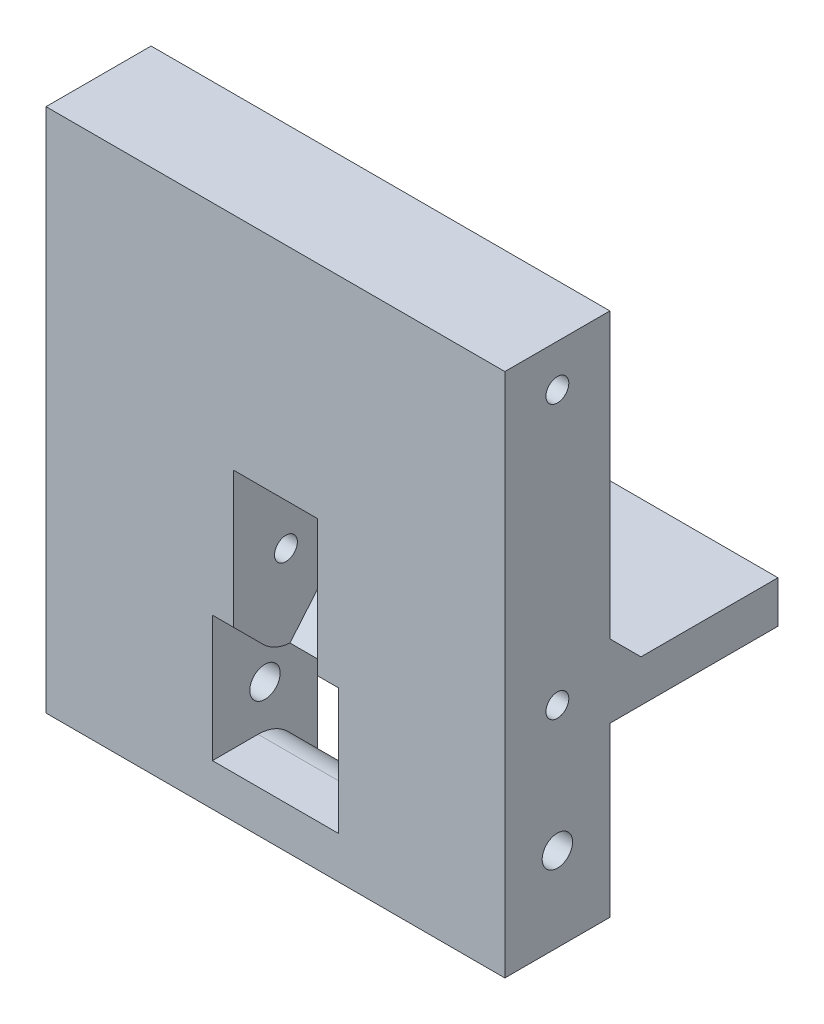
from build123d import *

# Parameters (mm, degrees)
SKETCH2_W               = 15.875
SKETCH2_H               = 79.375
SKETCH2_R               = 1.7272
SKETCH2_W_2             = 25.4
SKETCH2_H_2             = 6.35
BOSS_EXTRUDE1_DEPTH     = 69.85
SKETCH3_W               = 19.05
SKETCH3_H               = 12.7
CUT_EXTRUDE1_DEPTH      = 127
SKETCH4_R               = 2.2950679
CUT_EXTRUDE2_DEPTH      = 127
CHAMFER1_SIZE           = 6.35
FILLET2_R               = 6.35
CUT_EXTRUDE3_DEPTH      = 6.35
CUT_EXTRUDE3_DEPTH_BACK = 6.35
SKETCH8_R               = 2.4
SKETCH10_W              = 9.525
SKETCH10_H              = 4.699
BOSS_EXTRUDE2_DEPTH     = 12.7
SKETCH12_R              = 0.8763
CUT_EXTRUDE4_DEPTH      = 132.769283049
CHAMFER2_SIZE           = 4.7752
CHAMFER2_SIZE_2         = 12.7
CHAMFER3_SIZE           = 4.70154
CHAMFER4_SIZE           = 6.35
CHAMFER4_SIZE_2         = 12.7
CUT_EXTRUDE5_DEPTH      = 0.254
CUT_EXTRUDE6_DEPTH      = 0.254


# Some blends are built 0.0001 mm under size
with BuildPart() as part:
    # Sketch2 → Boss-Extrude1 (new body)
    # profile 1 of 2: a face of its own
    with BuildSketch(Plane.ZY.offset(62.053242547)):
        with Locations((17.149745439, 79.910239505)):
            Rectangle(SKETCH2_W, SKETCH2_H)
        with Locations((17.149745439, 113.247739505)):
            Circle(SKETCH2_R, mode=Mode.SUBTRACT)
        with Locations((17.149745439, 71.972739505)):
            Circle(SKETCH2_R, mode=Mode.SUBTRACT)
    # profile 2 of 2: a face of its own
    with BuildSketch(Plane.ZY.offset(62.053242547)):
        with Locations((-3.487754561, 68.797739505)):
            Rectangle(SKETCH2_W_2, SKETCH2_H_2)
    extrude(amount=-BOSS_EXTRUDE1_DEPTH)

    # Sketch3 → Cut-Extrude1 (cut)
    with BuildSketch(Plane(origin=(0, 0, 9.212245439), x_dir=(-1, 0, 0), z_dir=(0, 0, -1))):
        with Locations((27.128242547, 52.922739505)):
            Rectangle(SKETCH3_W, SKETCH3_H)
    extrude(amount=-CUT_EXTRUDE1_DEPTH, mode=Mode.SUBTRACT)

    # Sketch4 → Cut-Extrude2 (cut)
    with BuildSketch(Plane(origin=(7.796757453, 0, 0), x_dir=(0, 0, -1), z_dir=(1, 0, 0))):
        with Locations(Location((-17.149745439, 52.922739505, 0), (0, 0, 180))):
            Circle(SKETCH4_R)
    extrude(amount=-CUT_EXTRUDE2_DEPTH, mode=Mode.SUBTRACT)

    # Chamfer1
    chamfer1_edges = [part.edges().sort_by_distance(p)[0] for p in [
        (-27.128242547, 59.272739505, 25.087245439),
        (-27.128242547, 46.572739505, 9.212245439),
    ]]
    chamfer(chamfer1_edges, length=CHAMFER1_SIZE - 0.0001)  # a hair under: the kernel refuses the full size

    # Fillet2
    fillet2_edges = [part.edges().sort_by_distance(p)[0] for p in [
        (-27.128242547, 59.272739505, 18.737345439),
        (-27.128242547, 46.572739505, 15.562145439),
    ]]
    fillet(fillet2_edges, radius=FILLET2_R)

    # Sketch8 → Cut-Extrude3 (cut, two sides: drawn at the far end of the back side and taken through both)
    # profile 1 of 5: a face of its own
    with BuildSketch(Plane(origin=(-27.128242547, 59.272739505, 33.482952844), x_dir=(0, 0, 1), z_dir=(-1, 0, 0)).offset(-CUT_EXTRUDE3_DEPTH_BACK)):
        with BuildLine():
            Line((-7.077924175, -7.789561181), (-20.085542155, 7.712314277))
            ThreePointArc((-20.085542155, 7.712314277), (-21.190808514, 7.041102183), (-22.339064084, 6.446418612))
            Line((-22.339064084, 6.446418612), (-9.023677061, -9.422241709))
            Line((-9.023677061, -9.422241709), (-7.077924175, -7.789561181))
        make_face()
    # profile 2 of 5: a face of its own
    with BuildSketch(Plane(origin=(-27.128242547, 59.272739505, 33.482952844), x_dir=(0, 0, 1), z_dir=(-1, 0, 0)).offset(-CUT_EXTRUDE3_DEPTH_BACK)):
        with BuildLine():
            Line((-20.085542155, 7.712314277), (-24.270707405, 12.7))
            Line((-24.270707405, 12.7), (-26.21646029, 11.067319471))
            Line((-26.21646029, 11.067319471), (-22.339064084, 6.446418612))
            ThreePointArc((-22.339064084, 6.446418612), (-21.190808514, 7.041102183), (-20.085542155, 7.712314277))
        make_face()
    # profile 3 of 5: a face of its own
    with BuildSketch(Plane(origin=(-27.128242547, 59.272739505, 33.482952844), x_dir=(0, 0, 1), z_dir=(-1, 0, 0)).offset(-CUT_EXTRUDE3_DEPTH_BACK)):
        Polygon((-26.21646029, 11.067319471), (-24.270707405, 12.7), (-27.58644192, 12.7), align=None)
    # profile 4 of 5: a face of its own
    with BuildSketch(Plane(origin=(-27.128242547, 59.272739505, 33.482952844), x_dir=(0, 0, 1), z_dir=(-1, 0, 0)).offset(-CUT_EXTRUDE3_DEPTH_BACK)):
        with BuildLine():
            ThreePointArc((-11.470707405, 23.65), (-13.762240918, 14.591506693), (-20.085542155, 7.712314277))
            Line((-20.085542155, 7.712314277), (-7.077924175, -7.789561181))
            Line((-7.077924175, -7.789561181), (9.239394359, 5.902294783))
            Line((9.239394359, 5.902294783), (-15.927560764, 35.895103965))
            ThreePointArc((-15.927560764, 35.895103965), (-12.619562979, 30.16548373), (-11.470707405, 23.65))
        make_face()
    # profile 5 of 5: a face of its own
    with BuildSketch(Plane(origin=(-27.128242547, 59.272739505, 33.482952844), x_dir=(0, 0, 1), z_dir=(-1, 0, 0)).offset(-CUT_EXTRUDE3_DEPTH_BACK)):
        with BuildLine():
            Line((-27.58644192, 12.7), (-24.270707405, 12.7))
            Line((-24.270707405, 12.7), (-20.085542155, 7.712314277))
            ThreePointArc((-20.085542155, 7.712314277), (-13.762240918, 14.591506693), (-11.470707405, 23.65))
            ThreePointArc((-11.470707405, 23.65), (-12.619562979, 30.16548373), (-15.927560764, 35.895103965))
            ThreePointArc((-15.927560764, 35.895103965), (-42.128931765, 38.754688915), (-46.109164673, 12.7))
            Line((-46.109164673, 12.7), (-27.58644192, 12.7))
        make_face()
        with Locations((-30.520707405, 23.65)):
            Circle(SKETCH8_R, mode=Mode.SUBTRACT)
    extrude(amount=CUT_EXTRUDE3_DEPTH + CUT_EXTRUDE3_DEPTH_BACK, mode=Mode.SUBTRACT)

    # Sketch10 → Boss-Extrude2 (add)
    with BuildSketch(Plane(origin=(0, 0, 9.212245439), x_dir=(-1, 0, 0), z_dir=(0, 0, -1))):
        with Locations((46.262342601, 74.322239505)):
            Rectangle(SKETCH10_W, SKETCH10_H)
        with Locations((46.262342601, 102.311439505)):
            Rectangle(SKETCH10_W, SKETCH10_H)
    extrude(amount=BOSS_EXTRUDE2_DEPTH)

    # Sketch12 → Cut-Extrude4 (cut, through all)
    with BuildSketch(Plane(origin=(-41.499842601, 0, 0), x_dir=(0, 0, -1), z_dir=(1, 0, 0))):
        with Locations((-2.862245439, 101.816839505)):
            Circle(SKETCH12_R)
        with Locations((-2.862245439, 74.816839505)):
            Circle(SKETCH12_R)
    extrude(amount=-CUT_EXTRUDE4_DEPTH, mode=Mode.SUBTRACT)

    # Chamfer2
    # the kernel refuses this chamfer: 12.7, 4.7752 mm, written as the material it adds along each edge
    with BuildSketch(Plane(origin=(-41.499842601, 104.660939505, 9.212245439), x_dir=(0, 0.9954252149618871, 0.09554392402492679), z_dir=(-1, 0, 0))) as chamfer2_piece_1:
        Polygon((CHAMFER2_SIZE * 0.995425214962, CHAMFER2_SIZE * 0.0955439240249), (-CHAMFER2_SIZE_2 * 0.0955439240249, CHAMFER2_SIZE_2 * 0.995425214962), (0, 0), align=None)
    extrude(amount=9.525)

    # Chamfer3
    # the kernel refuses this chamfer: 4.70154 mm, written as the material it adds along each edge
    with BuildSketch(Plane(origin=(-62.053242547, 71.972739505, 9.212245439), x_dir=(0, 0.9996219169112968, 0.02749587661058452), z_dir=(1, 0, 0))) as chamfer3_piece_1_section:
        Polygon((CHAMFER3_SIZE * 0.999621916911, -CHAMFER3_SIZE * 0.0274958766106), (-CHAMFER3_SIZE * 0.0274958766106, -CHAMFER3_SIZE * 0.999621916911), (0, 0), align=None)
    chamfer3_piece_1 = extrude(amount=23.119270381, mode=Mode.PRIVATE)
    chamfer3_piece_1 = split(chamfer3_piece_1, bisect_by=Plane(origin=(-41.499842601, 76.672586172, 9.211398772), z_dir=(-1, 0, 0)), keep=Keep.TOP, mode=Mode.PRIVATE)
    add(chamfer3_piece_1)
    with BuildSketch(Plane(origin=(-20.778242547, 71.972739505, 9.212245439), x_dir=(0, 0.9996219169112968, 0.02749587661058452), z_dir=(1, 0, 0))) as chamfer3_piece_2:
        Polygon((CHAMFER3_SIZE * 0.999621916911, -CHAMFER3_SIZE * 0.0274958766106), (-CHAMFER3_SIZE * 0.0274958766106, -CHAMFER3_SIZE * 0.999621916911), (0, 0), align=None)
    extrude(amount=28.575)

    # Chamfer4
    # the kernel refuses this chamfer: 12.7, 6.35 mm, written as the material it adds along each edge
    with BuildSketch(Plane(origin=(-51.024842601, 142.326966202, 9.212245439), x_dir=(-0.9976223042390326, -2.633779610739709e-14, 0.06891834360170875), z_dir=(0, -1, 0))) as chamfer4_piece_1_section:
        Polygon((CHAMFER4_SIZE * 0.997622304239, CHAMFER4_SIZE * 0.0689183436017), (-CHAMFER4_SIZE_2 * 0.0689183436017, CHAMFER4_SIZE_2 * 0.997622304239), (0, 0), align=None)
    chamfer4_piece_1 = extrude(amount=42.365026697, mode=Mode.PRIVATE)
    chamfer4_piece_1 = split(chamfer4_piece_1, bisect_by=Plane(origin=(-53.26388473, 107.534062678, 4.153530473), z_dir=(0, -0.9360210850035494, 0.35194392796122825)), keep=Keep.TOP, mode=Mode.PRIVATE)
    chamfer4_piece_1 = chamfer4_piece_1 - Plane(origin=(-53.26388473, 101.816839505, 2.862245439), x_dir=(0, 0, -1), z_dir=(1, 0, 0)) * Cylinder(0.8763, 136, mode=Mode.PRIVATE)
    add(chamfer4_piece_1)

    # Sketch13 → Cut-Extrude5 (cut)
    with BuildSketch(Plane(origin=(7.796757453, 0, 0), x_dir=(0, 0, -1), z_dir=(1, 0, 0))):
        Polygon((16.187754561, 65.622739505), (16.187754561, 71.972739505), (-4.510705439, 71.972739505), (-9.212245439, 76.674279505), (-9.212245439, 119.597739505), (-25.087245439, 119.597739505), (-25.087245439, 40.222739505), (-9.212245439, 40.222739505), (-9.212245439, 65.622739505), align=None)
    extrude(amount=-CUT_EXTRUDE5_DEPTH, mode=Mode.SUBTRACT)

    # Sketch14 → Cut-Extrude6 (cut)
    with BuildSketch(Plane.ZY.offset(62.053242547)):
        Polygon((-16.187754561, 71.972739505), (-16.187754561, 65.622739505), (9.212245439, 65.622739505), (9.212245439, 40.222739505), (25.087245439, 40.222739505), (25.087245439, 119.597739505), (9.212245439, 119.597739505), (9.212245439, 76.674279505), (4.510705439, 71.972739505), align=None)
    extrude(amount=-CUT_EXTRUDE6_DEPTH, mode=Mode.SUBTRACT)


solid = part.part
